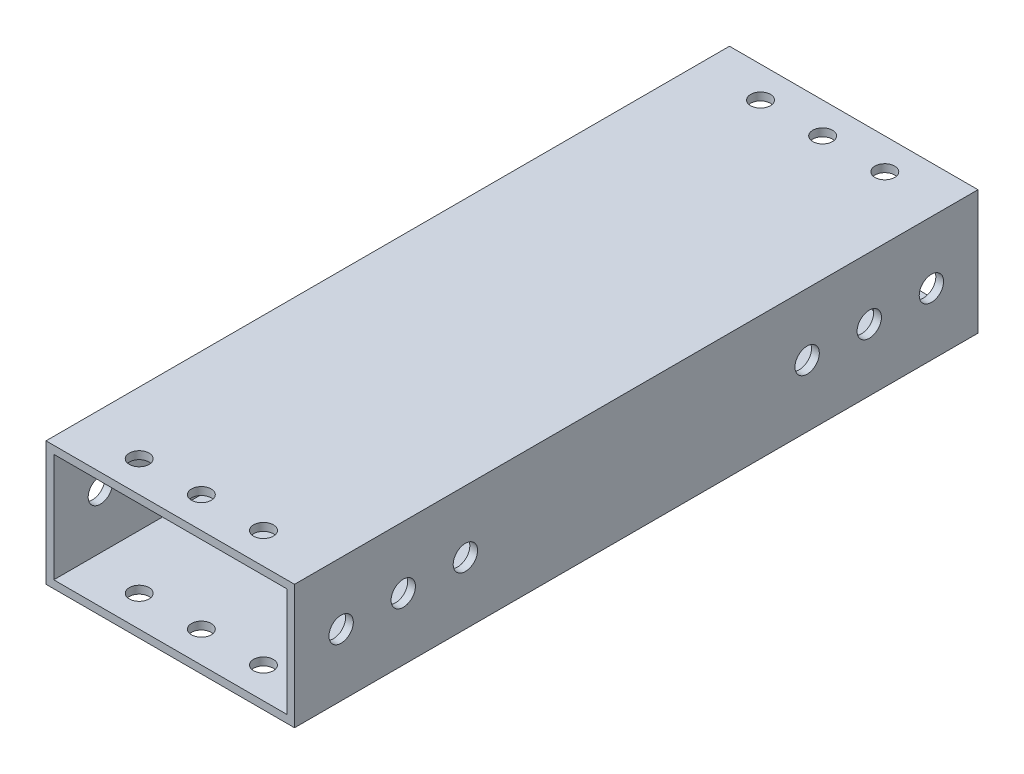
from build123d import *

# Parameters (mm, degrees)
SKETCH1_W           = 50.8
SKETCH1_H           = 25.4
SKETCH1_W_2         = 47.625
SKETCH1_H_2         = 22.225
BOSS_EXTRUDE1_DEPTH = 69.85
SKETCH2_R           = 2.0193
CUT_EXTRUDE1_DEPTH  = 79.545162168
SKETCH3_R           = 2.4892
CUT_EXTRUDE2_DEPTH  = 88.298066989


with BuildPart() as part:
    # Sketch1 → Boss-Extrude1 (new, symmetric)
    with BuildSketch(Plane.XY):
        Rectangle(SKETCH1_W, SKETCH1_H)
        Rectangle(SKETCH1_W_2, SKETCH1_H_2, mode=Mode.SUBTRACT)
    extrude(amount=BOSS_EXTRUDE1_DEPTH, both=True)

    # Sketch2 → Cut-Extrude1 (cut, through all)
    with BuildSketch(Plane(origin=(0, 12.7, 0), x_dir=(1, 0, 0), z_dir=(0, 1, 0))):
        with Locations((-12.7, 63.5)):
            Circle(SKETCH2_R)
        with Locations((0, 63.5)):
            Circle(SKETCH2_R)
        with Locations((12.7, 63.5)):
            Circle(SKETCH2_R)
        with Locations((12.7, -63.5)):
            Circle(SKETCH2_R)
        with Locations((0, -63.5)):
            Circle(SKETCH2_R)
        with Locations((-12.7, -63.5)):
            Circle(SKETCH2_R)
    extrude(amount=-CUT_EXTRUDE1_DEPTH, mode=Mode.SUBTRACT)

    # Sketch3 → Cut-Extrude2 (cut, through all)
    with BuildSketch(Plane(origin=(25.4, 0, 0), x_dir=(0, 0, -1), z_dir=(1, 0, 0))):
        with Locations((-60.325, 0)):
            Circle(SKETCH3_R)
        with Locations((60.325, 0)):
            Circle(SKETCH3_R)
        with Locations((-47.625, 0)):
            Circle(SKETCH3_R)
        with Locations((-34.925, 0)):
            Circle(SKETCH3_R)
        with Locations((34.925, 0)):
            Circle(SKETCH3_R)
        with Locations((47.625, 0)):
            Circle(SKETCH3_R)
    extrude(amount=-CUT_EXTRUDE2_DEPTH, mode=Mode.SUBTRACT)


solid = part.part
